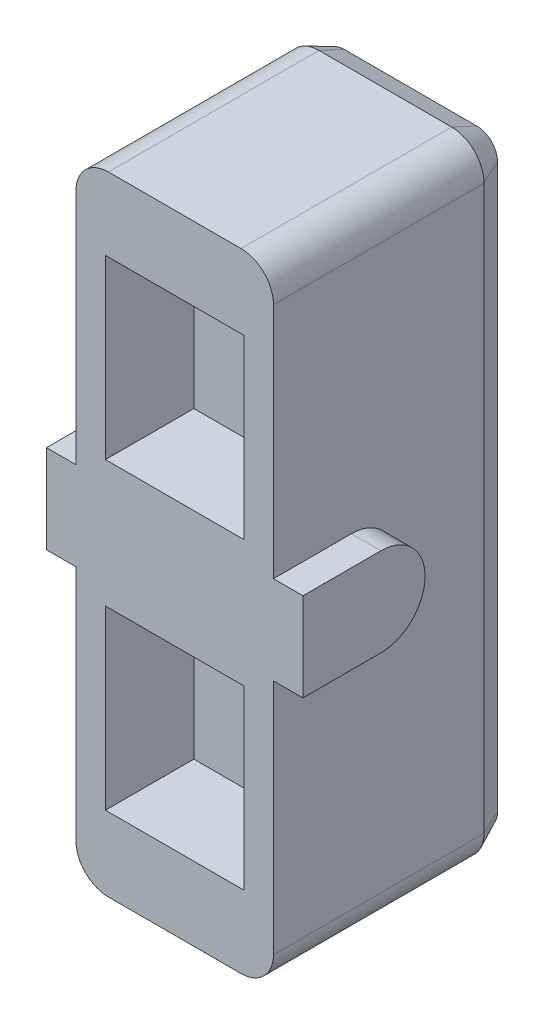
from build123d import *

# Parameters (mm, degrees)
BOSS_EXTRU_1_DEPTH      = 8
CHANFREIN1_SIZE         = 0.4
CHANFREIN1_SIZE2        = 0.857802768
BOSS_EXTRU_2_DEPTH      = 0.2
ENL_V_MAT_EXTRU_3_DEPTH = 0.2
ESQUISSE3_W             = 4.7
ESQUISSE3_H             = 6
ENL_V_MAT_EXTRU_4_DEPTH = 3
BOSS_EXTRU_3_DEPTH      = 1
BOSS_EXTRU_3_DEPTH_BACK = 7.7


with BuildPart() as part:
    # Esquisse2 → Boss.-Extru.1 (new body)
    with BuildSketch(Plane.XY):
        with BuildLine():
            Line((1.1, 0), (5.6, 0))
            ThreePointArc((5.6, 0), (6.377817459, 0.322182541), (6.7, 1.1))
            Line((6.7, 1.1), (6.7, 20.2))
            ThreePointArc((6.7, 20.2), (6.377817459, 20.977817459), (5.6, 21.3))
            Line((5.6, 21.3), (1.1, 21.3))
            ThreePointArc((1.1, 21.3), (0.322182541, 20.977817459), (0, 20.2))
            Line((0, 20.2), (0, 1.1))
            ThreePointArc((0, 1.1), (0.322182541, 0.322182541), (1.1, 0))
        make_face()
    extrude(amount=BOSS_EXTRU_1_DEPTH)

    # Chanfrein1
    chanfrein1_edges = [part.edges().sort_by_distance(p)[0] for p in [
        (3.35, 0, 0),
        (6.377817459, 0.322182541, 0),
        (0.322182541, 0.322182541, 0),
        (6.7, 10.65, 0),
        (0, 10.65, 0),
        (6.377817459, 20.977817459, 0),
        (0.322182541, 20.977817459, 0),
        (3.35, 21.3, 0),
    ]]
    chanfrein1_side = [part.faces().sort_by_distance(p)[0] for p in [
        (3.35, 10.65, 0),
    ]]
    chamfer(chanfrein1_edges, length=CHANFREIN1_SIZE, length2=CHANFREIN1_SIZE2, reference=chanfrein1_side[0])

    # Esquisse5<4> → Boss.-Extru.2 (add)
    # profile 1 of 5: a face of its own
    with BuildSketch(Plane.XY):
        Polygon((1.54, 5.9), (5.159538913, 5.9), (3.349812525, 1.9), align=None)
        Polygon((3.349799516, 3.355553525), (2.47002862, 5.3), (4.22952854, 5.3), align=None, mode=Mode.SUBTRACT)
    # profile 2 of 5: a face of its own
    with BuildSketch(Plane.XY):
        Polygon((1.54, 15.4), (5.16, 15.4), (3.35, 19.4), align=None)
        Polygon((2.470068334, 16), (4.229931666, 16), (3.35, 17.944600368), align=None, mode=Mode.SUBTRACT)
    # profile 3 of 5: a face of its own
    with BuildSketch(Plane.XY):
        with BuildLine():
            Line((5.795512821, 12.154141058), (5.407391827, 12.154141058))
            add(Edge.make_bspline(
                [(5.407391827, 12.154141058), (5.381517307, 12.154032478), (5.331933593, 12.153824404), (5.26062264, 12.152600644), (5.195874704, 12.149241545), (5.137537019, 12.146276691), (5.085993105, 12.140912869), (5.040797324, 12.135849382), (5.002130665, 12.129030353), (4.978841318, 12.122893486), (4.968189103, 12.120086571)],
                knots=[0, 0, 0, 0, 1.406291012, 2.694895705, 3.875596585, 4.929939196, 5.86881668, 6.691431991, 7.401479668, 8, 8, 8, 8], degree=3))
            add(Edge.make_bspline(
                [(4.968189103, 12.120086571), (4.954063199, 12.115523302), (4.925781909, 12.106387238), (4.885399487, 12.087752057), (4.847033348, 12.06535587), (4.81026959, 12.040054054), (4.776202635, 12.010144401), (4.744112646, 11.976797985), (4.713249398, 11.940379466), (4.685738172, 11.899751226), (4.659787385, 11.856783074), (4.637996977, 11.810700046), (4.619473637, 11.762260941), (4.603645472, 11.711697634), (4.592523608, 11.658459313), (4.583972088, 11.602970119), (4.578136981, 11.545123417), (4.577756946, 11.505617824), (4.577564103, 11.485571346)],
                knots=[0, 0, 0, 0, 0.890219086, 1.782296258, 2.662026138, 3.55410331, 4.45596999, 5.376940187, 6.329934089, 7.316405561, 8.318020235, 9.33962404, 10.370274173, 11.428642517, 12.515222745, 13.630246086, 14.797506457, 16, 16, 16, 16], degree=3))
            add(Edge.make_bspline(
                [(4.577564103, 11.485571346), (4.578334908, 11.452298559), (4.579833538, 11.387608292), (4.594186954, 11.293693579), (4.617586529, 11.205887849), (4.650505819, 11.124733084), (4.691983992, 11.051414066), (4.741364779, 10.98659077), (4.799761454, 10.932105053), (4.854771772, 10.894253639), (4.903479564, 10.869949129), (4.943079104, 10.853031732), (4.986391635, 10.840011225), (5.032604871, 10.828233763), (5.082322289, 10.819371053), (5.135323366, 10.812972796), (5.191650719, 10.808890577), (5.230267969, 10.808294137), (5.250140224, 10.807987212)],
                knots=[0, 0, 0, 0, 1.463301985, 2.845009436, 4.168980889, 5.453965417, 6.687638921, 7.866010869, 9.024897383, 10.188268473, 10.789455717, 11.41836669, 12.080505235, 12.777114878, 13.516268487, 14.300753823, 15.125575917, 16, 16, 16, 16], degree=3))
            Line((5.250140224, 10.807987212), (4.545512821, 9.654141058))
            Line((4.545512821, 9.654141058), (4.790404647, 9.654141058))
            Line((4.790404647, 9.654141058), (5.495032051, 10.807987212))
            Line((5.495032051, 10.807987212), (5.603205128, 10.807987212))
            Line((5.603205128, 10.807987212), (5.603205128, 9.654141058))
            Line((5.603205128, 9.654141058), (5.795512821, 9.654141058))
            Line((5.795512821, 9.654141058), (5.795512821, 12.154141058))
        make_face()
        with BuildLine():
            Line((5.603205128, 11.897730802), (5.603205128, 11.064397468))
            Line((5.603205128, 11.064397468), (5.263161058, 11.060891859))
            add(Edge.make_bspline(
                [(5.263161058, 11.060891859), (5.232257502, 11.061431235), (5.174656248, 11.06243658), (5.094630256, 11.070556914), (5.027333969, 11.084389759), (4.971463313, 11.105070977), (4.925444637, 11.133432667), (4.885015146, 11.167366505), (4.850513464, 11.208927173), (4.821379233, 11.256707389), (4.799047975, 11.309563079), (4.781279584, 11.365574447), (4.772154101, 11.4250112), (4.770640213, 11.465513851), (4.769871795, 11.486072148)],
                knots=[0, 0, 0, 0, 1.484503796, 2.766972155, 3.858711607, 4.777707686, 5.612610321, 6.443380992, 7.3028828, 8.195570234, 9.122302869, 10.053363384, 11.011928053, 12, 12, 12, 12], degree=3))
            add(Edge.make_bspline(
                [(4.769871795, 11.486072148), (4.770572669, 11.506143755), (4.771954138, 11.545706245), (4.782078901, 11.60365119), (4.799240146, 11.658629265), (4.822762288, 11.710039796), (4.851222245, 11.756720092), (4.884633489, 11.797094231), (4.922470093, 11.829997482), (4.957931898, 11.851607434), (4.98951879, 11.864830715), (5.01674033, 11.873950815), (5.047769961, 11.881272622), (5.082433331, 11.88707257), (5.120494723, 11.892192648), (5.162114277, 11.895556333), (5.207384101, 11.897592153), (5.23878632, 11.897683306), (5.255148237, 11.897730802)],
                knots=[0, 0, 0, 0, 1.313944225, 2.589872584, 3.837965354, 5.075530782, 6.282894025, 7.408145269, 8.493011398, 9.552186356, 10.110521641, 10.732722405, 11.429993849, 12.195550865, 13.033463864, 13.943953869, 14.928710818, 16, 16, 16, 16], degree=3))
            Line((5.255148237, 11.897730802), (5.603205128, 11.897730802))
        make_face(mode=Mode.SUBTRACT)
    # profile 4 of 5: a face of its own
    with BuildSketch(Plane.XY):
        Polygon((4.487820513, 9.654141058), (4.487820513, 12.154141058), (4.447255609, 12.154141058), (3.141666667, 10.247590577), (3.141666667, 12.154141058), (2.949358974, 12.154141058), (2.949358974, 9.654141058), (2.992928686, 9.654141058), (4.295512821, 11.555683526), (4.295512821, 9.654141058), align=None)
    # profile 5 of 5: a face of its own
    with BuildSketch(Plane.XY):
        with BuildLine():
            Line((1.000641026, 11.727458366), (1.150380609, 11.545166699))
            add(Edge.make_bspline(
                [(1.150380609, 11.545166699), (1.176695263, 11.577706223), (1.227961264, 11.641099466), (1.312334784, 11.725725311), (1.400990226, 11.797357955), (1.492469789, 11.856337102), (1.584838061, 11.903342726), (1.677185455, 11.936591811), (1.768389989, 11.958017816), (1.82919024, 11.960577682), (1.859014423, 11.961833366)],
                knots=[0, 0, 0, 0, 1.180897879, 2.300615913, 3.366389015, 4.392591617, 5.368437861, 6.285267508, 7.158876892, 8, 8, 8, 8], degree=3))
            add(Edge.make_bspline(
                [(1.859014423, 11.961833366), (1.87740433, 11.961549056), (1.913988827, 11.960983457), (1.96833989, 11.953312346), (2.022018194, 11.9426347), (2.075027135, 11.926739186), (2.127521521, 11.906875649), (2.179315986, 11.882036016), (2.230460317, 11.853066656), (2.280201036, 11.819358175), (2.328810472, 11.782753639), (2.374270024, 11.741812014), (2.417673685, 11.698366983), (2.457576675, 11.650977576), (2.495254548, 11.600967664), (2.530007128, 11.547656102), (2.561357962, 11.490884571), (2.599955711, 11.411846744), (2.640093216, 11.308712806), (2.673901821, 11.180504338), (2.695325023, 11.048921804), (2.698007332, 10.959978242), (2.699358974, 10.915158686)],
                knots=[0, 0, 0, 0, 0.742195851, 1.476508881, 2.213078346, 2.951281721, 3.708907221, 4.477997883, 5.269176095, 6.080806104, 6.903452709, 7.724910218, 8.549764533, 9.38205395, 10.224901256, 11.077722799, 11.950072611, 12.842695263, 14.629531552, 16.409024752, 18.190471412, 20, 20, 20, 20], degree=3))
            add(Edge.make_bspline(
                [(2.699358974, 10.915158686), (2.69893839, 10.892111226), (2.698099101, 10.846119318), (2.692432716, 10.777580259), (2.68343536, 10.70988375), (2.670985263, 10.642950444), (2.654343785, 10.576968783), (2.634324285, 10.511761866), (2.610716019, 10.447581113), (2.583820904, 10.384641263), (2.553572164, 10.323822904), (2.519734722, 10.266195271), (2.484038644, 10.21154611), (2.444877249, 10.160632546), (2.403790329, 10.112427369), (2.358723183, 10.068459362), (2.311733121, 10.027071195), (2.261760977, 9.989672179), (2.20970894, 9.956358665), (2.156697143, 9.926355055), (2.10190602, 9.901938874), (2.045951122, 9.881881404), (1.988996672, 9.865525186), (1.930586629, 9.85495059), (1.871237215, 9.847277394), (1.831162054, 9.846726678), (1.8109375, 9.84644875)],
                knots=[0, 0, 0, 0, 1.075648671, 2.146489633, 3.207621231, 4.262009588, 5.322110962, 6.381840063, 7.444229469, 8.512289095, 9.575021281, 10.611993966, 11.629793255, 12.619316909, 13.608073431, 14.583229653, 15.555112222, 16.529022636, 17.492908616, 18.438097579, 19.369212982, 20.288485365, 21.211020687, 22.130920189, 23.056739734, 24, 24, 24, 24], degree=3))
            add(Edge.make_bspline(
                [(1.8109375, 9.84644875), (1.786528397, 9.847130326), (1.738502802, 9.848471345), (1.668063475, 9.858824971), (1.600470972, 9.875110605), (1.535977595, 9.899046901), (1.474174124, 9.929118588), (1.415129935, 9.965881636), (1.359481902, 10.009805608), (1.30703902, 10.059802537), (1.258731848, 10.115223704), (1.214991158, 10.175035023), (1.176424346, 10.238687056), (1.142994476, 10.306286152), (1.115765194, 10.378046383), (1.093107335, 10.45366935), (1.07537612, 10.533150725), (1.068322758, 10.587898318), (1.06474359, 10.615679519)],
                knots=[0, 0, 0, 0, 0.992732885, 1.953229764, 2.890514293, 3.816609624, 4.746085783, 5.682705685, 6.640557555, 7.625359646, 8.626536552, 9.627713458, 10.636418116, 11.650913816, 12.691491505, 13.75510899, 14.860849082, 16, 16, 16, 16], degree=3))
            Line((1.06474359, 10.615679519), (1.673717949, 10.615679519))
            Line((1.673717949, 10.615679519), (1.673717949, 10.872089776))
            Line((1.673717949, 10.872089776), (0.872435897, 10.872089776))
            add(Edge.make_bspline(
                [(0.872435897, 10.872089776), (0.873353611, 10.824321344), (0.87514736, 10.730953878), (0.887582726, 10.594704223), (0.908745078, 10.466099065), (0.936976056, 10.344935881), (0.973552816, 10.231324441), (1.01796694, 10.12523645), (1.070972215, 10.026898752), (1.131133181, 9.936506571), (1.198202274, 9.855206488), (1.270983514, 9.783991915), (1.34961648, 9.723801126), (1.434025155, 9.674912681), (1.523753458, 9.636450473), (1.619024427, 9.609550884), (1.719723051, 9.593116469), (1.788671568, 9.591080481), (1.823958333, 9.590038494)],
                knots=[0, 0, 0, 0, 1.279979538, 2.501828927, 3.662287385, 4.770080211, 5.832462613, 6.856844025, 7.847542677, 8.821456207, 9.761900772, 10.666623651, 11.544302252, 12.408204966, 13.273981784, 14.15325484, 15.054864909, 16, 16, 16, 16], degree=3))
            add(Edge.make_bspline(
                [(1.823958333, 9.590038494), (1.845505591, 9.590446838), (1.888168908, 9.591255355), (1.951362325, 9.596991936), (2.012995224, 9.605690415), (2.072791525, 9.619018229), (2.130989495, 9.635257824), (2.187244499, 9.656079306), (2.24192592, 9.680165802), (2.295191529, 9.707543354), (2.346292954, 9.739441063), (2.395929542, 9.774380944), (2.443763634, 9.813216007), (2.489717174, 9.855745729), (2.534032737, 9.902080741), (2.576403805, 9.952278446), (2.617699551, 10.005692803), (2.642990052, 10.043606998), (2.655789263, 10.062794904)],
                knots=[0, 0, 0, 0, 1.032382545, 2.044105334, 3.038476821, 4.012827536, 4.97754274, 5.931586725, 6.884288403, 7.839538852, 8.798533035, 9.768407888, 10.746592774, 11.748528567, 12.766901797, 13.816738798, 14.895078446, 16, 16, 16, 16], degree=3))
            add(Edge.make_bspline(
                [(2.655789263, 10.062794904), (2.674648603, 10.093397312), (2.71239576, 10.154648336), (2.760023766, 10.251497345), (2.801074184, 10.351620391), (2.833859291, 10.455579552), (2.860127817, 10.562941489), (2.878467763, 10.673929937), (2.889830177, 10.788383427), (2.891049211, 10.865886448), (2.891666667, 10.905142661)],
                knots=[0, 0, 0, 0, 0.972045947, 1.945559608, 2.915893918, 3.89712903, 4.891732452, 5.90371772, 6.93820781, 8, 8, 8, 8], degree=3))
            add(Edge.make_bspline(
                [(2.891666667, 10.905142661), (2.891334206, 10.93453639), (2.890674114, 10.992896799), (2.883782378, 11.079621379), (2.873460708, 11.164711636), (2.858725522, 11.248243931), (2.840544386, 11.330287942), (2.817064555, 11.410699826), (2.790411877, 11.489812472), (2.758633363, 11.566682266), (2.724014487, 11.640881591), (2.685879509, 11.711393194), (2.644188787, 11.777492703), (2.599763823, 11.839724097), (2.551950883, 11.897516195), (2.501257188, 11.951205732), (2.447694878, 12.001124162), (2.390501009, 12.045977095), (2.331227199, 12.086511685), (2.269861678, 12.121869692), (2.206298853, 12.151492818), (2.141084257, 12.176090293), (2.073639678, 12.194695414), (2.004485371, 12.208033121), (1.933371946, 12.217096145), (1.885251106, 12.2178593), (1.861017628, 12.218243622)],
                knots=[0, 0, 0, 0, 1.139613768, 2.262670523, 3.371514243, 4.462374492, 5.550696422, 6.628397115, 7.709281568, 8.786379394, 9.852056274, 10.883259988, 11.892634097, 12.880693113, 13.846294527, 14.798787622, 15.742440682, 16.682668171, 17.614523987, 18.525044925, 19.425686334, 20.331084297, 21.224742707, 22.135010483, 23.060798158, 24, 24, 24, 24], degree=3))
            add(Edge.make_bspline(
                [(1.861017628, 12.218243622), (1.841307413, 12.217820539), (1.801979104, 12.216976349), (1.743597983, 12.211364936), (1.686083072, 12.202264171), (1.629309184, 12.189830343), (1.573453493, 12.173317885), (1.518519666, 12.153017131), (1.464322435, 12.129647654), (1.411061465, 12.1018317), (1.358395274, 12.070210029), (1.306064976, 12.034416184), (1.254003637, 11.994367437), (1.202386416, 11.949674618), (1.151263026, 11.900344283), (1.100370861, 11.846823345), (1.04951427, 11.78920369), (1.01714774, 11.748312566), (1.000641026, 11.727458366)],
                knots=[0, 0, 0, 0, 0.919647238, 1.834996262, 2.733959633, 3.635416665, 4.54488085, 5.449260826, 6.366695346, 7.296870797, 8.250651732, 9.231496765, 10.253508801, 11.31380595, 12.415577929, 13.567028811, 14.759200909, 16, 16, 16, 16], degree=3))
        make_face()
    extrude(amount=-BOSS_EXTRU_2_DEPTH)

    # Esquisse5 → Enlèv. mat.-Extru.3 (cut)
    # profile 1 of 5: a face of its own
    with BuildSketch(Plane.XY):
        Polygon((1.54, 5.9), (5.159538913, 5.9), (3.349812525, 1.9), align=None)
        Polygon((3.349799516, 3.355553525), (2.47002862, 5.3), (4.22952854, 5.3), align=None, mode=Mode.SUBTRACT)
    # profile 2 of 5: a face of its own
    with BuildSketch(Plane.XY):
        Polygon((1.54, 15.4), (5.16, 15.4), (3.35, 19.4), align=None)
        Polygon((2.470068334, 16), (4.229931666, 16), (3.35, 17.944600368), align=None, mode=Mode.SUBTRACT)
    # profile 3 of 5: a face of its own
    with BuildSketch(Plane.XY):
        with BuildLine():
            Line((5.795512821, 12.154141058), (5.407391827, 12.154141058))
            add(Edge.make_bspline(
                [(5.407391827, 12.154141058), (5.381517307, 12.154032478), (5.331933593, 12.153824404), (5.26062264, 12.152600644), (5.195874704, 12.149241545), (5.137537019, 12.146276691), (5.085993105, 12.140912869), (5.040797324, 12.135849382), (5.002130665, 12.129030353), (4.978841318, 12.122893486), (4.968189103, 12.120086571)],
                knots=[0, 0, 0, 0, 1.406291012, 2.694895705, 3.875596585, 4.929939196, 5.86881668, 6.691431991, 7.401479668, 8, 8, 8, 8], degree=3))
            add(Edge.make_bspline(
                [(4.968189103, 12.120086571), (4.954063199, 12.115523302), (4.925781909, 12.106387238), (4.885399487, 12.087752057), (4.847033348, 12.06535587), (4.81026959, 12.040054054), (4.776202635, 12.010144401), (4.744112646, 11.976797985), (4.713249398, 11.940379466), (4.685738172, 11.899751226), (4.659787385, 11.856783074), (4.637996977, 11.810700046), (4.619473637, 11.762260941), (4.603645472, 11.711697634), (4.592523608, 11.658459313), (4.583972088, 11.602970119), (4.578136981, 11.545123417), (4.577756946, 11.505617824), (4.577564103, 11.485571346)],
                knots=[0, 0, 0, 0, 0.890219086, 1.782296258, 2.662026138, 3.55410331, 4.45596999, 5.376940187, 6.329934089, 7.316405561, 8.318020235, 9.33962404, 10.370274173, 11.428642517, 12.515222745, 13.630246086, 14.797506457, 16, 16, 16, 16], degree=3))
            add(Edge.make_bspline(
                [(4.577564103, 11.485571346), (4.578334908, 11.452298559), (4.579833538, 11.387608292), (4.594186954, 11.293693579), (4.617586529, 11.205887849), (4.650505819, 11.124733084), (4.691983992, 11.051414066), (4.741364779, 10.98659077), (4.799761454, 10.932105053), (4.854771772, 10.894253639), (4.903479564, 10.869949129), (4.943079104, 10.853031732), (4.986391635, 10.840011225), (5.032604871, 10.828233763), (5.082322289, 10.819371053), (5.135323366, 10.812972796), (5.191650719, 10.808890577), (5.230267969, 10.808294137), (5.250140224, 10.807987212)],
                knots=[0, 0, 0, 0, 1.463301985, 2.845009436, 4.168980889, 5.453965417, 6.687638921, 7.866010869, 9.024897383, 10.188268473, 10.789455717, 11.41836669, 12.080505235, 12.777114878, 13.516268487, 14.300753823, 15.125575917, 16, 16, 16, 16], degree=3))
            Line((5.250140224, 10.807987212), (4.545512821, 9.654141058))
            Line((4.545512821, 9.654141058), (4.790404647, 9.654141058))
            Line((4.790404647, 9.654141058), (5.495032051, 10.807987212))
            Line((5.495032051, 10.807987212), (5.603205128, 10.807987212))
            Line((5.603205128, 10.807987212), (5.603205128, 9.654141058))
            Line((5.603205128, 9.654141058), (5.795512821, 9.654141058))
            Line((5.795512821, 9.654141058), (5.795512821, 12.154141058))
        make_face()
        with BuildLine():
            Line((5.603205128, 11.897730802), (5.603205128, 11.064397468))
            Line((5.603205128, 11.064397468), (5.263161058, 11.060891859))
            add(Edge.make_bspline(
                [(5.263161058, 11.060891859), (5.232257502, 11.061431235), (5.174656248, 11.06243658), (5.094630256, 11.070556914), (5.027333969, 11.084389759), (4.971463313, 11.105070977), (4.925444637, 11.133432667), (4.885015146, 11.167366505), (4.850513464, 11.208927173), (4.821379233, 11.256707389), (4.799047975, 11.309563079), (4.781279584, 11.365574447), (4.772154101, 11.4250112), (4.770640213, 11.465513851), (4.769871795, 11.486072148)],
                knots=[0, 0, 0, 0, 1.484503796, 2.766972155, 3.858711607, 4.777707686, 5.612610321, 6.443380992, 7.3028828, 8.195570234, 9.122302869, 10.053363384, 11.011928053, 12, 12, 12, 12], degree=3))
            add(Edge.make_bspline(
                [(4.769871795, 11.486072148), (4.770572669, 11.506143755), (4.771954138, 11.545706245), (4.782078901, 11.60365119), (4.799240146, 11.658629265), (4.822762288, 11.710039796), (4.851222245, 11.756720092), (4.884633489, 11.797094231), (4.922470093, 11.829997482), (4.957931898, 11.851607434), (4.98951879, 11.864830715), (5.01674033, 11.873950815), (5.047769961, 11.881272622), (5.082433331, 11.88707257), (5.120494723, 11.892192648), (5.162114277, 11.895556333), (5.207384101, 11.897592153), (5.23878632, 11.897683306), (5.255148237, 11.897730802)],
                knots=[0, 0, 0, 0, 1.313944225, 2.589872584, 3.837965354, 5.075530782, 6.282894025, 7.408145269, 8.493011398, 9.552186356, 10.110521641, 10.732722405, 11.429993849, 12.195550865, 13.033463864, 13.943953869, 14.928710818, 16, 16, 16, 16], degree=3))
            Line((5.255148237, 11.897730802), (5.603205128, 11.897730802))
        make_face(mode=Mode.SUBTRACT)
    # profile 4 of 5: a face of its own
    with BuildSketch(Plane.XY):
        Polygon((4.487820513, 9.654141058), (4.487820513, 12.154141058), (4.447255609, 12.154141058), (3.141666667, 10.247590577), (3.141666667, 12.154141058), (2.949358974, 12.154141058), (2.949358974, 9.654141058), (2.992928686, 9.654141058), (4.295512821, 11.555683526), (4.295512821, 9.654141058), align=None)
    # profile 5 of 5: a face of its own
    with BuildSketch(Plane.XY):
        with BuildLine():
            Line((1.000641026, 11.727458366), (1.150380609, 11.545166699))
            add(Edge.make_bspline(
                [(1.150380609, 11.545166699), (1.176695263, 11.577706223), (1.227961264, 11.641099466), (1.312334784, 11.725725311), (1.400990226, 11.797357955), (1.492469789, 11.856337102), (1.584838061, 11.903342726), (1.677185455, 11.936591811), (1.768389989, 11.958017816), (1.82919024, 11.960577682), (1.859014423, 11.961833366)],
                knots=[0, 0, 0, 0, 1.180897879, 2.300615913, 3.366389015, 4.392591617, 5.368437861, 6.285267508, 7.158876892, 8, 8, 8, 8], degree=3))
            add(Edge.make_bspline(
                [(1.859014423, 11.961833366), (1.87740433, 11.961549056), (1.913988827, 11.960983457), (1.96833989, 11.953312346), (2.022018194, 11.9426347), (2.075027135, 11.926739186), (2.127521521, 11.906875649), (2.179315986, 11.882036016), (2.230460317, 11.853066656), (2.280201036, 11.819358175), (2.328810472, 11.782753639), (2.374270024, 11.741812014), (2.417673685, 11.698366983), (2.457576675, 11.650977576), (2.495254548, 11.600967664), (2.530007128, 11.547656102), (2.561357962, 11.490884571), (2.599955711, 11.411846744), (2.640093216, 11.308712806), (2.673901821, 11.180504338), (2.695325023, 11.048921804), (2.698007332, 10.959978242), (2.699358974, 10.915158686)],
                knots=[0, 0, 0, 0, 0.742195851, 1.476508881, 2.213078346, 2.951281721, 3.708907221, 4.477997883, 5.269176095, 6.080806104, 6.903452709, 7.724910218, 8.549764533, 9.38205395, 10.224901256, 11.077722799, 11.950072611, 12.842695263, 14.629531552, 16.409024752, 18.190471412, 20, 20, 20, 20], degree=3))
            add(Edge.make_bspline(
                [(2.699358974, 10.915158686), (2.69893839, 10.892111226), (2.698099101, 10.846119318), (2.692432716, 10.777580259), (2.68343536, 10.70988375), (2.670985263, 10.642950444), (2.654343785, 10.576968783), (2.634324285, 10.511761866), (2.610716019, 10.447581113), (2.583820904, 10.384641263), (2.553572164, 10.323822904), (2.519734722, 10.266195271), (2.484038644, 10.21154611), (2.444877249, 10.160632546), (2.403790329, 10.112427369), (2.358723183, 10.068459362), (2.311733121, 10.027071195), (2.261760977, 9.989672179), (2.20970894, 9.956358665), (2.156697143, 9.926355055), (2.10190602, 9.901938874), (2.045951122, 9.881881404), (1.988996672, 9.865525186), (1.930586629, 9.85495059), (1.871237215, 9.847277394), (1.831162054, 9.846726678), (1.8109375, 9.84644875)],
                knots=[0, 0, 0, 0, 1.075648671, 2.146489633, 3.207621231, 4.262009588, 5.322110962, 6.381840063, 7.444229469, 8.512289095, 9.575021281, 10.611993966, 11.629793255, 12.619316909, 13.608073431, 14.583229653, 15.555112222, 16.529022636, 17.492908616, 18.438097579, 19.369212982, 20.288485365, 21.211020687, 22.130920189, 23.056739734, 24, 24, 24, 24], degree=3))
            add(Edge.make_bspline(
                [(1.8109375, 9.84644875), (1.786528397, 9.847130326), (1.738502802, 9.848471345), (1.668063475, 9.858824971), (1.600470972, 9.875110605), (1.535977595, 9.899046901), (1.474174124, 9.929118588), (1.415129935, 9.965881636), (1.359481902, 10.009805608), (1.30703902, 10.059802537), (1.258731848, 10.115223704), (1.214991158, 10.175035023), (1.176424346, 10.238687056), (1.142994476, 10.306286152), (1.115765194, 10.378046383), (1.093107335, 10.45366935), (1.07537612, 10.533150725), (1.068322758, 10.587898318), (1.06474359, 10.615679519)],
                knots=[0, 0, 0, 0, 0.992732885, 1.953229764, 2.890514293, 3.816609624, 4.746085783, 5.682705685, 6.640557555, 7.625359646, 8.626536552, 9.627713458, 10.636418116, 11.650913816, 12.691491505, 13.75510899, 14.860849082, 16, 16, 16, 16], degree=3))
            Line((1.06474359, 10.615679519), (1.673717949, 10.615679519))
            Line((1.673717949, 10.615679519), (1.673717949, 10.872089776))
            Line((1.673717949, 10.872089776), (0.872435897, 10.872089776))
            add(Edge.make_bspline(
                [(0.872435897, 10.872089776), (0.873353611, 10.824321344), (0.87514736, 10.730953878), (0.887582726, 10.594704223), (0.908745078, 10.466099065), (0.936976056, 10.344935881), (0.973552816, 10.231324441), (1.01796694, 10.12523645), (1.070972215, 10.026898752), (1.131133181, 9.936506571), (1.198202274, 9.855206488), (1.270983514, 9.783991915), (1.34961648, 9.723801126), (1.434025155, 9.674912681), (1.523753458, 9.636450473), (1.619024427, 9.609550884), (1.719723051, 9.593116469), (1.788671568, 9.591080481), (1.823958333, 9.590038494)],
                knots=[0, 0, 0, 0, 1.279979538, 2.501828927, 3.662287385, 4.770080211, 5.832462613, 6.856844025, 7.847542677, 8.821456207, 9.761900772, 10.666623651, 11.544302252, 12.408204966, 13.273981784, 14.15325484, 15.054864909, 16, 16, 16, 16], degree=3))
            add(Edge.make_bspline(
                [(1.823958333, 9.590038494), (1.845505591, 9.590446838), (1.888168908, 9.591255355), (1.951362325, 9.596991936), (2.012995224, 9.605690415), (2.072791525, 9.619018229), (2.130989495, 9.635257824), (2.187244499, 9.656079306), (2.24192592, 9.680165802), (2.295191529, 9.707543354), (2.346292954, 9.739441063), (2.395929542, 9.774380944), (2.443763634, 9.813216007), (2.489717174, 9.855745729), (2.534032737, 9.902080741), (2.576403805, 9.952278446), (2.617699551, 10.005692803), (2.642990052, 10.043606998), (2.655789263, 10.062794904)],
                knots=[0, 0, 0, 0, 1.032382545, 2.044105334, 3.038476821, 4.012827536, 4.97754274, 5.931586725, 6.884288403, 7.839538852, 8.798533035, 9.768407888, 10.746592774, 11.748528567, 12.766901797, 13.816738798, 14.895078446, 16, 16, 16, 16], degree=3))
            add(Edge.make_bspline(
                [(2.655789263, 10.062794904), (2.674648603, 10.093397312), (2.71239576, 10.154648336), (2.760023766, 10.251497345), (2.801074184, 10.351620391), (2.833859291, 10.455579552), (2.860127817, 10.562941489), (2.878467763, 10.673929937), (2.889830177, 10.788383427), (2.891049211, 10.865886448), (2.891666667, 10.905142661)],
                knots=[0, 0, 0, 0, 0.972045947, 1.945559608, 2.915893918, 3.89712903, 4.891732452, 5.90371772, 6.93820781, 8, 8, 8, 8], degree=3))
            add(Edge.make_bspline(
                [(2.891666667, 10.905142661), (2.891334206, 10.93453639), (2.890674114, 10.992896799), (2.883782378, 11.079621379), (2.873460708, 11.164711636), (2.858725522, 11.248243931), (2.840544386, 11.330287942), (2.817064555, 11.410699826), (2.790411877, 11.489812472), (2.758633363, 11.566682266), (2.724014487, 11.640881591), (2.685879509, 11.711393194), (2.644188787, 11.777492703), (2.599763823, 11.839724097), (2.551950883, 11.897516195), (2.501257188, 11.951205732), (2.447694878, 12.001124162), (2.390501009, 12.045977095), (2.331227199, 12.086511685), (2.269861678, 12.121869692), (2.206298853, 12.151492818), (2.141084257, 12.176090293), (2.073639678, 12.194695414), (2.004485371, 12.208033121), (1.933371946, 12.217096145), (1.885251106, 12.2178593), (1.861017628, 12.218243622)],
                knots=[0, 0, 0, 0, 1.139613768, 2.262670523, 3.371514243, 4.462374492, 5.550696422, 6.628397115, 7.709281568, 8.786379394, 9.852056274, 10.883259988, 11.892634097, 12.880693113, 13.846294527, 14.798787622, 15.742440682, 16.682668171, 17.614523987, 18.525044925, 19.425686334, 20.331084297, 21.224742707, 22.135010483, 23.060798158, 24, 24, 24, 24], degree=3))
            add(Edge.make_bspline(
                [(1.861017628, 12.218243622), (1.841307413, 12.217820539), (1.801979104, 12.216976349), (1.743597983, 12.211364936), (1.686083072, 12.202264171), (1.629309184, 12.189830343), (1.573453493, 12.173317885), (1.518519666, 12.153017131), (1.464322435, 12.129647654), (1.411061465, 12.1018317), (1.358395274, 12.070210029), (1.306064976, 12.034416184), (1.254003637, 11.994367437), (1.202386416, 11.949674618), (1.151263026, 11.900344283), (1.100370861, 11.846823345), (1.04951427, 11.78920369), (1.01714774, 11.748312566), (1.000641026, 11.727458366)],
                knots=[0, 0, 0, 0, 0.919647238, 1.834996262, 2.733959633, 3.635416665, 4.54488085, 5.449260826, 6.366695346, 7.296870797, 8.250651732, 9.231496765, 10.253508801, 11.31380595, 12.415577929, 13.567028811, 14.759200909, 16, 16, 16, 16], degree=3))
        make_face()
    extrude(amount=ENL_V_MAT_EXTRU_3_DEPTH, mode=Mode.SUBTRACT)


with BuildPart() as enl_v_mat_extru_3_piece_1:
    # of the separate pieces the step leaves, piece 1, a body of its own (enl_v_mat_extru_3_pieces)
    add(part.part.solids().sort_by_distance((0, 20.2, 0.857802768))[0])

    # Esquisse3 → Enlèv. mat.-Extru.4 (cut)
    with BuildSketch(Plane.XY.offset(8)):
        with Locations((3.35, 15.8)):
            Rectangle(ESQUISSE3_W, ESQUISSE3_H)
        with Locations((3.35, 5.5)):
            Rectangle(ESQUISSE3_W, ESQUISSE3_H)
    extrude(amount=-ENL_V_MAT_EXTRU_4_DEPTH, mode=Mode.SUBTRACT)

    # Esquisse6 → Boss.-Extru.3 (add, two sides: drawn at the far end of the back side and taken through both)
    with BuildSketch(Plane.ZY.offset(-BOSS_EXTRU_3_DEPTH_BACK)):
        with BuildLine():
            Line((5.357802768, 12.15), (8, 12.15))
            Line((8, 12.15), (8, 9.15))
            Line((8, 9.15), (5.357802768, 9.15))
            ThreePointArc((5.357802768, 9.15), (3.857802768, 10.65), (5.357802768, 12.15))
        make_face()
    extrude(amount=BOSS_EXTRU_3_DEPTH + BOSS_EXTRU_3_DEPTH_BACK)


with BuildPart() as enl_v_mat_extru_3_piece_2:
    # of the separate pieces the step leaves, piece 2, a body of its own (enl_v_mat_extru_3_pieces)
    add(part.part.solids().sort_by_distance((1.54, 15.4, -0.2))[0])


with BuildPart() as enl_v_mat_extru_3_piece_3:
    # of the separate pieces the step leaves, piece 3, a body of its own (enl_v_mat_extru_3_pieces)
    add(part.part.solids().sort_by_distance((3.349812525, 1.9, -0.2))[0])


with BuildPart() as enl_v_mat_extru_3_piece_4:
    # of the separate pieces the step leaves, piece 4, a body of its own (enl_v_mat_extru_3_pieces)
    add(part.part.solids().sort_by_distance((1.000641026, 11.727458366, -0.2))[0])


with BuildPart() as enl_v_mat_extru_3_piece_5:
    # of the separate pieces the step leaves, piece 5, a body of its own (enl_v_mat_extru_3_pieces)
    add(part.part.solids().sort_by_distance((4.487820513, 9.654141058, -0.2))[0])


with BuildPart() as enl_v_mat_extru_3_piece_6:
    # of the separate pieces the step leaves, piece 6, a body of its own (enl_v_mat_extru_3_pieces)
    add(part.part.solids().sort_by_distance((5.795512821, 12.154141058, -0.2))[0])


solid = Compound([enl_v_mat_extru_3_piece_1.part, enl_v_mat_extru_3_piece_2.part, enl_v_mat_extru_3_piece_3.part, enl_v_mat_extru_3_piece_4.part, enl_v_mat_extru_3_piece_5.part, enl_v_mat_extru_3_piece_6.part])
